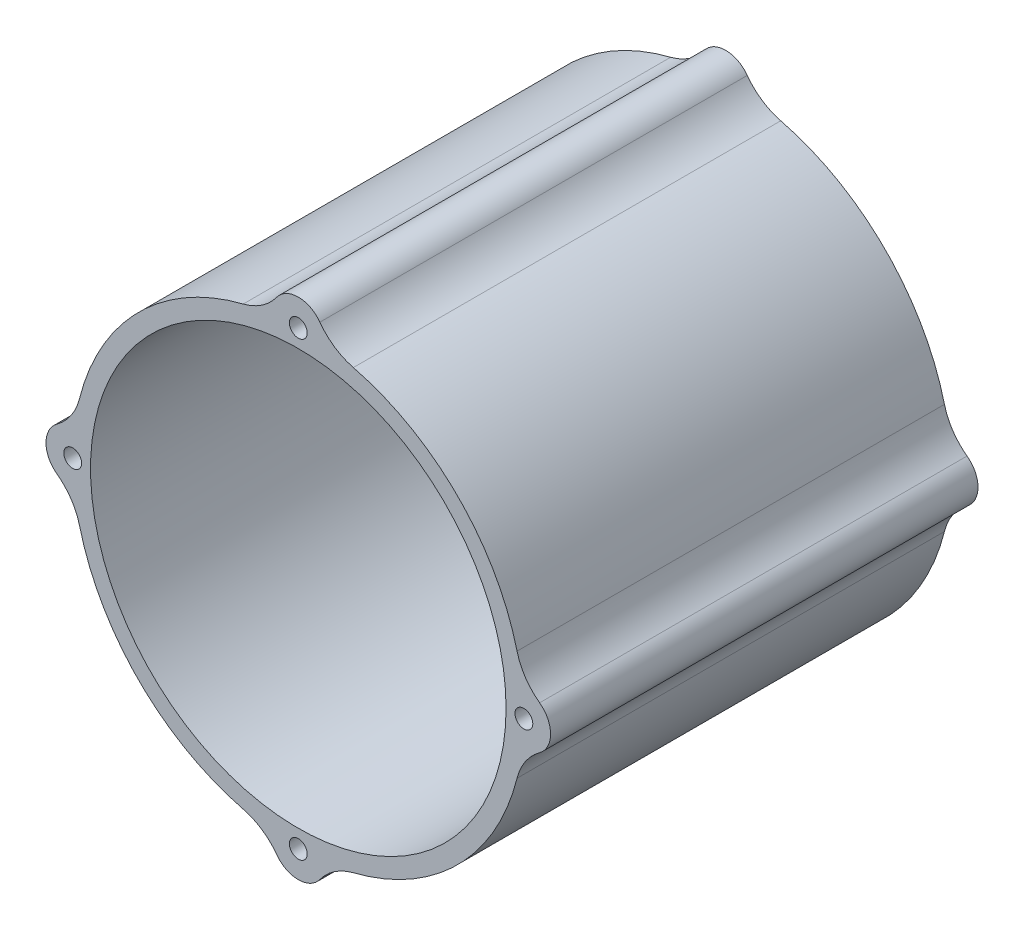
from build123d import *

# Parameters (mm, degrees)
IZIM1_R                     = 35
IZIM1_R_2                   = 1.5
Y_KSEKLIK_EKSTR_ZYON1_DEPTH = 72


with BuildPart() as part:
    # Çizim1 → Yükseklik-Ekstrüzyon1 (new body)
    with BuildSketch(Plane.XY):
        with BuildLine():
            ThreePointArc((-36.8515625, -9.271587853), (-26.870057685, -26.870057685), (-9.271587853, -36.8515625))
            ThreePointArc((-9.271587853, -36.8515625), (-6.120072686, -38.258614089), (-3.634597053, -40.653244102))
            ThreePointArc((-3.634597053, -40.653244102), (0, -42.5), (3.634597053, -40.653244102))
            ThreePointArc((3.634597053, -40.653244102), (6.120072686, -38.258614089), (9.271587853, -36.8515625))
            ThreePointArc((9.271587853, -36.8515625), (26.870057685, -26.870057685), (36.8515625, -9.271587853))
            ThreePointArc((36.8515625, -9.271587853), (38.258614089, -6.120072686), (40.653244102, -3.634597053))
            ThreePointArc((40.653244102, -3.634597053), (42.5, 0), (40.653244102, 3.634597053))
            ThreePointArc((40.653244102, 3.634597053), (38.258614089, 6.120072686), (36.8515625, 9.271587853))
            ThreePointArc((36.8515625, 9.271587853), (26.870057685, 26.870057685), (9.271587853, 36.8515625))
            ThreePointArc((9.271587853, 36.8515625), (6.120072686, 38.258614089), (3.634597053, 40.653244102))
            ThreePointArc((3.634597053, 40.653244102), (0, 42.5), (-3.634597053, 40.653244102))
            ThreePointArc((-3.634597053, 40.653244102), (-6.120072686, 38.258614089), (-9.271587853, 36.8515625))
            ThreePointArc((-9.271587853, 36.8515625), (-26.870057685, 26.870057685), (-36.8515625, 9.271587853))
            ThreePointArc((-36.8515625, 9.271587853), (-38.258614089, 6.120072686), (-40.653244102, 3.634597053))
            ThreePointArc((-40.653244102, 3.634597053), (-42.5, 0), (-40.653244102, -3.634597053))
            ThreePointArc((-40.653244102, -3.634597053), (-38.258614089, -6.120072686), (-36.8515625, -9.271587853))
        make_face()
        Circle(IZIM1_R, mode=Mode.SUBTRACT)
        with Locations((-38, 0)):
            Circle(IZIM1_R_2, mode=Mode.SUBTRACT)
        with Locations((0, 38)):
            Circle(IZIM1_R_2, mode=Mode.SUBTRACT)
        with Locations((38, 0)):
            Circle(IZIM1_R_2, mode=Mode.SUBTRACT)
        with Locations((0, -38)):
            Circle(IZIM1_R_2, mode=Mode.SUBTRACT)
    extrude(amount=Y_KSEKLIK_EKSTR_ZYON1_DEPTH)


solid = part.part
